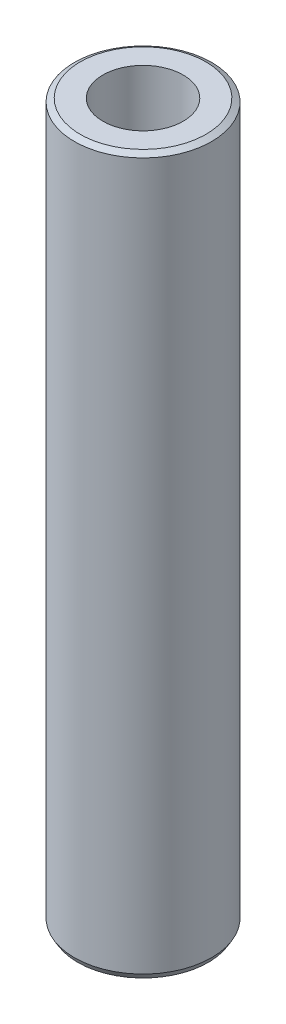
from build123d import *
from OCP.BRepFilletAPI import BRepFilletAPI_MakeChamfer

# Parameters (mm, degrees)
SKETCH1_R           = 57.5
BOSS_EXTRUDE1_DEPTH = 600
SKETCH2_R           = 33.6478027
CUT_EXTRUDE1_DEPTH  = 606.485342515
CHAMFER1_SIZE       = 2.792194679
CHAMFER1_SIZE2      = 4.836223049


with BuildPart() as part:
    # Sketch1 → Boss-Extrude1 (new body)
    with BuildSketch(Plane(origin=(0, 0, 0), x_dir=(1, 0, 0), z_dir=(0, 1, 0))):
        Circle(SKETCH1_R)
    extrude(amount=BOSS_EXTRUDE1_DEPTH)

    # Sketch2 → Cut-Extrude1 (cut, through all)
    with BuildSketch(Plane(origin=(0, 0, 0), x_dir=(1, 0, 0), z_dir=(0, 1, 0))):
        Circle(SKETCH2_R)
    extrude(amount=CUT_EXTRUDE1_DEPTH, mode=Mode.SUBTRACT)

    # Chamfer1: one chamfer whose edges measure the first distance from different faces: ONE call of the kernel's chamfer builder (chamfer() names one face for all edges)
    chamfer1_edges_1 = [part.edges().sort_by_distance(p)[0] for p in [
        (-57.5, 600, 0),
    ]]
    chamfer1_side_1 = [part.faces().sort_by_distance(p)[0] for p in [
        (-57.5, 300, 0),
    ]]
    chamfer1_edges_2 = [part.edges().sort_by_distance(p)[0] for p in [
        (-57.5, 0, 0),
    ]]
    chamfer1_side_2 = [part.faces().sort_by_distance(p)[0] for p in [
        (-55.873654403, 0, 0),
    ]]
    chamfer1 = BRepFilletAPI_MakeChamfer(part.part.solid().wrapped)
    for e in chamfer1_edges_1:
        chamfer1.Add(CHAMFER1_SIZE, CHAMFER1_SIZE2, e.wrapped, chamfer1_side_1[0].wrapped)  # the first distance lies on this face
    for e in chamfer1_edges_2:
        chamfer1.Add(CHAMFER1_SIZE, CHAMFER1_SIZE2, e.wrapped, chamfer1_side_2[0].wrapped)  # the first distance lies on this face
    add(Compound.cast(chamfer1.Shape()), mode=Mode.REPLACE)


solid = part.part
